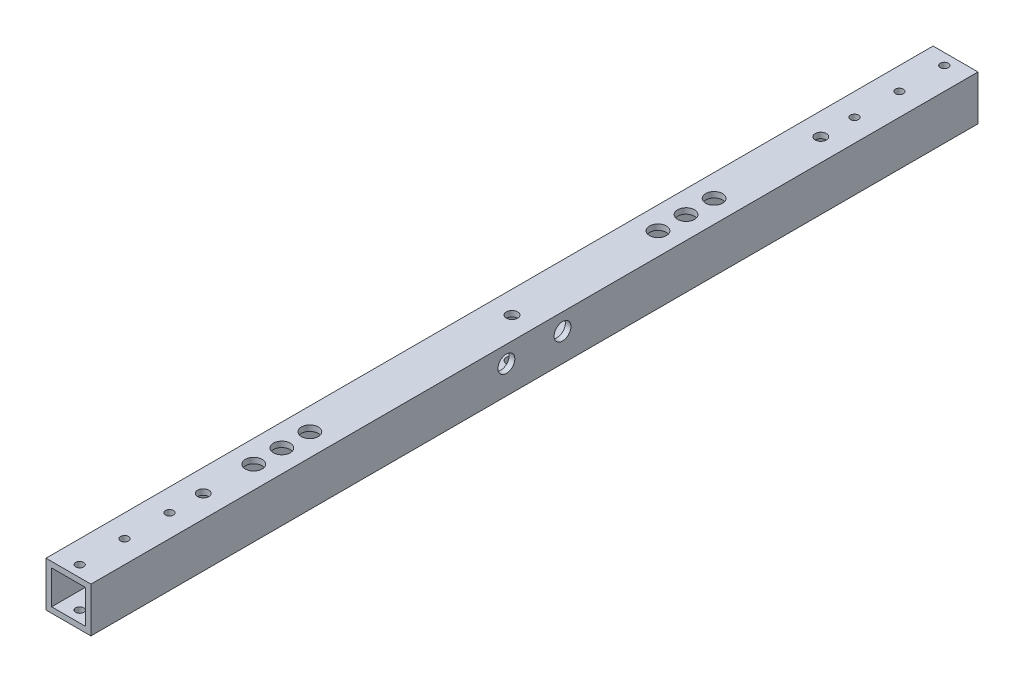
from build123d import *

# Parameters (mm, degrees)
SKETCH1_W                       = 25.4
SKETCH1_H                       = 25.4
SKETCH1_W_2                     = 19.05
SKETCH1_H_2                     = 19.05
EXTRUDE_THIN1_DEPTH             = 501.65
F_8_CLEARANCE_HOLE1_D           = 4.4958
F_1_4_0_25_DIAMETER_HOLE1_D     = 6.35
F_1_4_0_25_DIAMETER_HOLE1_DEPTH = 28.575
F_1_4_0_25_DIAMETER_HOLE1_TIP   = 1.907732465
F_3_8_0_375_DIAMETER_HOLE2_D    = 9.525
F_3_8_0_375_DIAMETER_HOLE3_D    = 9.525


with BuildPart() as part:
    # Sketch1 → Extrude-Thin1 (new body)
    with BuildSketch(Plane.XY):
        Rectangle(SKETCH1_W, SKETCH1_H)
        Rectangle(SKETCH1_W_2, SKETCH1_H_2, mode=Mode.SUBTRACT)
    extrude(amount=EXTRUDE_THIN1_DEPTH)

    # #8 Clearance Hole1 (through all)
    with Locations(Plane(origin=(0, 12.7, 495.3), x_dir=(0, 0, 1), z_dir=(0, 1, 0))):
        with Locations((0, 0), (-488.95, 0), (-463.55, 0), (-438.15, 0), (-25.4, 0), (-50.8, 0)):
            Hole(F_8_CLEARANCE_HOLE1_D / 2)

    # 1/4 (0.25) Diameter Hole1
    with Locations(Plane(origin=(381, 12.7, 250.825), x_dir=(1, 0, 0), z_dir=(0, 1, 0))):
        with Locations((-381, 174.625), (-381, 0), (-381, -174.625)):
            Hole(F_1_4_0_25_DIAMETER_HOLE1_D / 2, depth=F_1_4_0_25_DIAMETER_HOLE1_DEPTH)
            with Locations((0, 0, -(F_1_4_0_25_DIAMETER_HOLE1_DEPTH + F_1_4_0_25_DIAMETER_HOLE1_TIP / 2))):  # 118° drill point
                Cone(0, F_1_4_0_25_DIAMETER_HOLE1_D / 2, F_1_4_0_25_DIAMETER_HOLE1_TIP, mode=Mode.SUBTRACT)

    # 3/8 (0.375) Diameter Hole2 (through all)
    with Locations(Plane(origin=(381, 12.7, 250.825), x_dir=(1, 0, 0), z_dir=(0, 1, 0))):
        with Locations((-92.583, 346.075), (-35.433, 346.075), (35.814, 346.075), (92.964, 346.075), (-22.9616, -346.775), (50.0634, -346.775), (123.0884, -346.775), (-381, 114.3), (-381, 98.425), (-381, 82.55), (-381, -114.3), (-381, -130.175), (-381, -146.05)):
            Hole(F_3_8_0_375_DIAMETER_HOLE2_D / 2)

    # 3/8 (0.375) Diameter Hole3 (through all)
    with Locations(Plane(origin=(12.7, -82.55, 250.825), x_dir=(0, 0, -1), z_dir=(1, 0, 0))):
        with Locations((-15.875, 85.725), (15.875, 85.725), (15.875, 53.975), (-15.875, 53.975)):
            Hole(F_3_8_0_375_DIAMETER_HOLE3_D / 2)


solid = part.part
